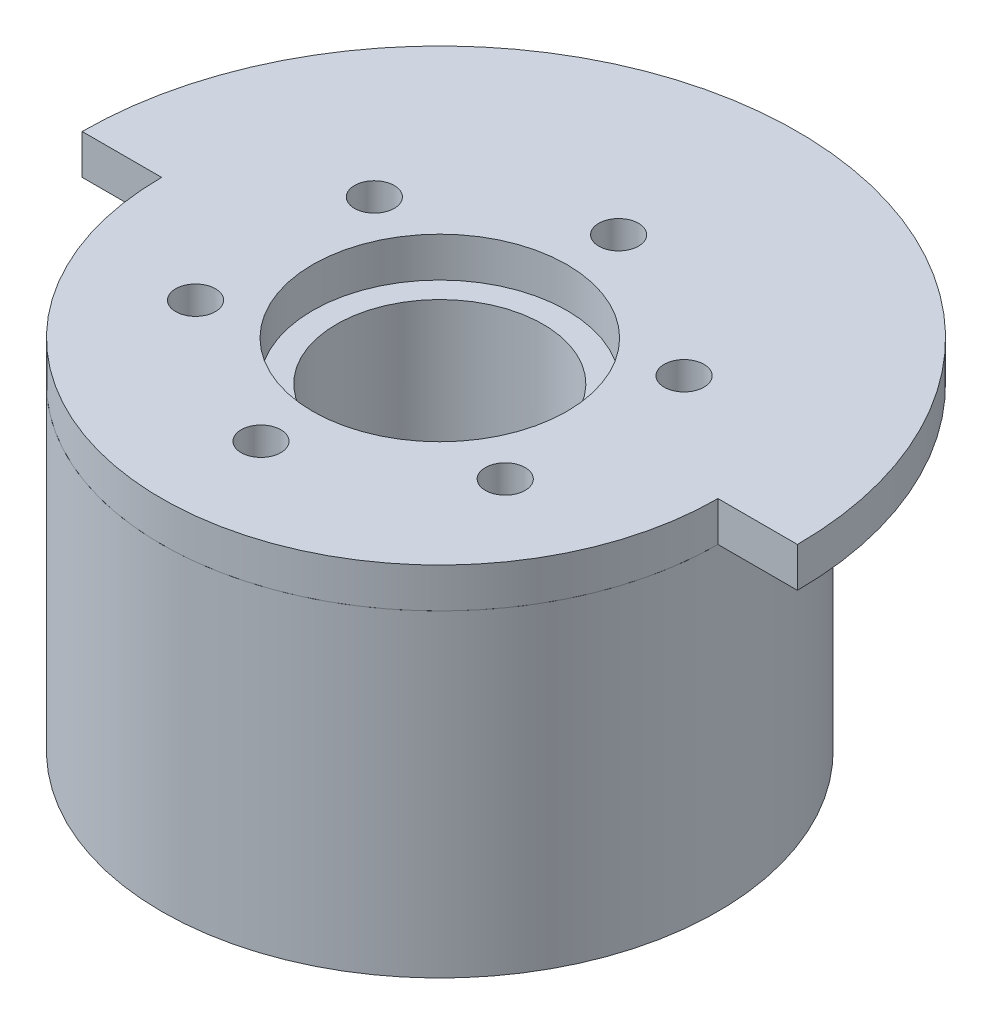
from build123d import *

# Parameters (mm, degrees)
SKETCH1_R                 = 35
SKETCH1_R_2               = 5
SKETCH1_R_3               = 2.5
BOSS_EXTRUDE1_DEPTH       = 40
SKETCH2_R                 = 16
CUT_EXTRUDE1_DEPTH        = 5
SKETCH5_R                 = 13
CUT_EXTRUDE2_DEPTH        = 35
BOSS_EXTRUDE2_OUTLINE_R   = 2.5
BOSS_EXTRUDE2_OUTLINE_R_2 = 13
BOSS_EXTRUDE2_DEPTH       = 5
CUT_EXTRUDE3_START        = -5
SKETCH7_R                 = 16
CUT_EXTRUDE3_DEPTH        = 5


# Read off the part's stored shape, not the designer's step: Boss-Extrude2
with BuildPart() as part:
    # Sketch1 → Boss-Extrude1 (new body)
    with BuildSketch(Plane(origin=(0, 0, 0), x_dir=(1, 0, 0), z_dir=(0, 1, 0))):
        with Locations(Location((0, 0, 0), (0, 0, 270))):
            Circle(SKETCH1_R)
        with Locations(Location((0, 0, 0), (0, 0, 270))):
            Circle(SKETCH1_R_2, mode=Mode.SUBTRACT)
        with Locations(Location((0, 22.5, 0), (0, 0, 270))):
            Circle(SKETCH1_R_3, mode=Mode.SUBTRACT)
        with Locations(Location((19.485571585, 11.25, 0), (0, 0, 270))):
            Circle(SKETCH1_R_3, mode=Mode.SUBTRACT)
        with Locations(Location((19.485571585, -11.25, 0), (0, 0, 270))):
            Circle(SKETCH1_R_3, mode=Mode.SUBTRACT)
        with Locations(Location((0, -22.5, 0), (0, 0, 270))):
            Circle(SKETCH1_R_3, mode=Mode.SUBTRACT)
        with Locations(Location((-19.485571585, -11.25, 0), (0, 0, 270))):
            Circle(SKETCH1_R_3, mode=Mode.SUBTRACT)
        with Locations(Location((-19.485571585, 11.25, 0), (0, 0, 270))):
            Circle(SKETCH1_R_3, mode=Mode.SUBTRACT)
    extrude(amount=BOSS_EXTRUDE1_DEPTH)

    # Sketch2 → Cut-Extrude1 (cut)
    with BuildSketch(Plane.XZ):
        with Locations(Location((0, 0, 0), (0, 0, 270))):
            Circle(SKETCH2_R)
    extrude(amount=-CUT_EXTRUDE1_DEPTH, mode=Mode.SUBTRACT)

    # Sketch5 → Cut-Extrude2 (cut)
    with BuildSketch(Plane(origin=(0, 40, 0), x_dir=(1, 0, 0), z_dir=(0, 1, 0))):
        with Locations(Location((0, 0, 0), (0, 0, 270))):
            Circle(SKETCH5_R)
    extrude(amount=-CUT_EXTRUDE2_DEPTH, mode=Mode.SUBTRACT)


with BuildPart() as body_2:
    # Boss-Extrude2 outline → Boss-Extrude2 (new body)
    with BuildSketch(Plane(origin=(0, 40, 0), x_dir=(1, 0, 0), z_dir=(0, 1, 0))):
        with BuildLine():
            Line((35, 0), (45, 0))
            ThreePointArc((45, 0), (0, 45), (-45, 0))
            Line((-45, 0), (-35, 0))
            ThreePointArc((-35, 0), (0, -35), (35, 0))
        make_face()
        with Locations((-19.485571585, -11.25)):
            Circle(BOSS_EXTRUDE2_OUTLINE_R, mode=Mode.SUBTRACT)
        with Locations((0, -22.5)):
            Circle(BOSS_EXTRUDE2_OUTLINE_R, mode=Mode.SUBTRACT)
        with Locations((19.485571585, -11.25)):
            Circle(BOSS_EXTRUDE2_OUTLINE_R, mode=Mode.SUBTRACT)
        Circle(BOSS_EXTRUDE2_OUTLINE_R_2, mode=Mode.SUBTRACT)
        with Locations((-19.485571585, 11.25)):
            Circle(BOSS_EXTRUDE2_OUTLINE_R, mode=Mode.SUBTRACT)
        with Locations((19.485571585, 11.25)):
            Circle(BOSS_EXTRUDE2_OUTLINE_R, mode=Mode.SUBTRACT)
        with Locations((0, 22.5)):
            Circle(BOSS_EXTRUDE2_OUTLINE_R, mode=Mode.SUBTRACT)
    extrude(amount=BOSS_EXTRUDE2_DEPTH)

    # Sketch7 → Cut-Extrude3 (cut)
    with BuildSketch(Plane(origin=(0, 45, 0), x_dir=(1, 0, 0), z_dir=(0, 1, 0)).offset(CUT_EXTRUDE3_START)):
        with Locations(Location((0, 0, 0), (0, 0, 270))):
            Circle(SKETCH7_R)
    extrude(amount=CUT_EXTRUDE3_DEPTH, mode=Mode.SUBTRACT)


solid = Compound([part.part, body_2.part])
